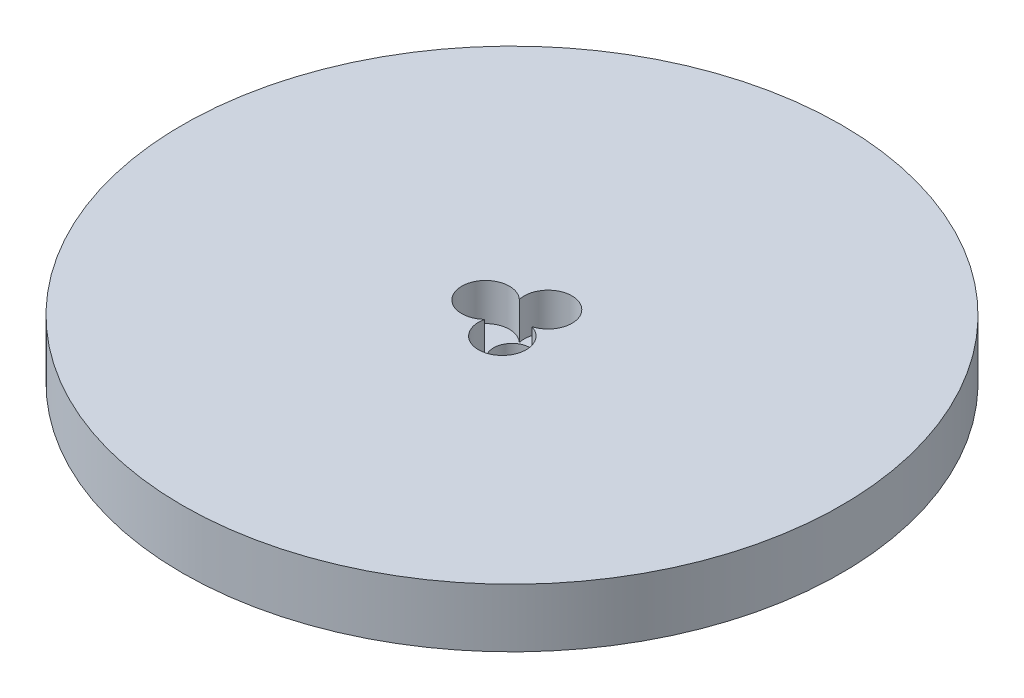
from build123d import *

# Parameters (mm, degrees)
SKETCH1_R           = 90
BOSS_EXTRUDE1_DEPTH = 16
SKETCH2_R           = 5
CUT_EXTRUDE1_DEPTH  = 129.280941687
SKETCH3_R           = 6.513808384
CUT_EXTRUDE2_DEPTH  = 10.201451925
CIRPATTERN1_COUNT   = 3


with BuildPart() as part:
    # Sketch1 → Boss-Extrude1 (new body)
    with BuildSketch(Plane(origin=(0, 0, 0), x_dir=(1, 0, 0), z_dir=(0, 1, 0))):
        Circle(SKETCH1_R)
    extrude(amount=BOSS_EXTRUDE1_DEPTH)

    # Sketch2 → Cut-Extrude1 (cut, through all)
    with BuildSketch(Plane(origin=(0, 0, 0), x_dir=(1, 0, 0), z_dir=(0, 1, 0))):
        Circle(SKETCH2_R)
    extrude(amount=CUT_EXTRUDE1_DEPTH, mode=Mode.SUBTRACT)

    # Sketch3 → Cut-Extrude2 (cut)
    with BuildSketch(Plane(origin=(0, 16, 0), x_dir=(1, 0, 0), z_dir=(0, 1, 0))):
        with Locations((-7.214525681, 0)):
            Circle(SKETCH3_R)
    cut_extrude2 = extrude(amount=-CUT_EXTRUDE2_DEPTH, mode=Mode.SUBTRACT)

    # CirPattern1: Cut-Extrude2 ×3 about axis
    cirpattern1_axis = Axis((0, 0, 0), (0, 1, 0))
    for i in range(1, CIRPATTERN1_COUNT):
        add(cut_extrude2.rotate(cirpattern1_axis, i * 360 / CIRPATTERN1_COUNT), mode=Mode.SUBTRACT)


solid = part.part
